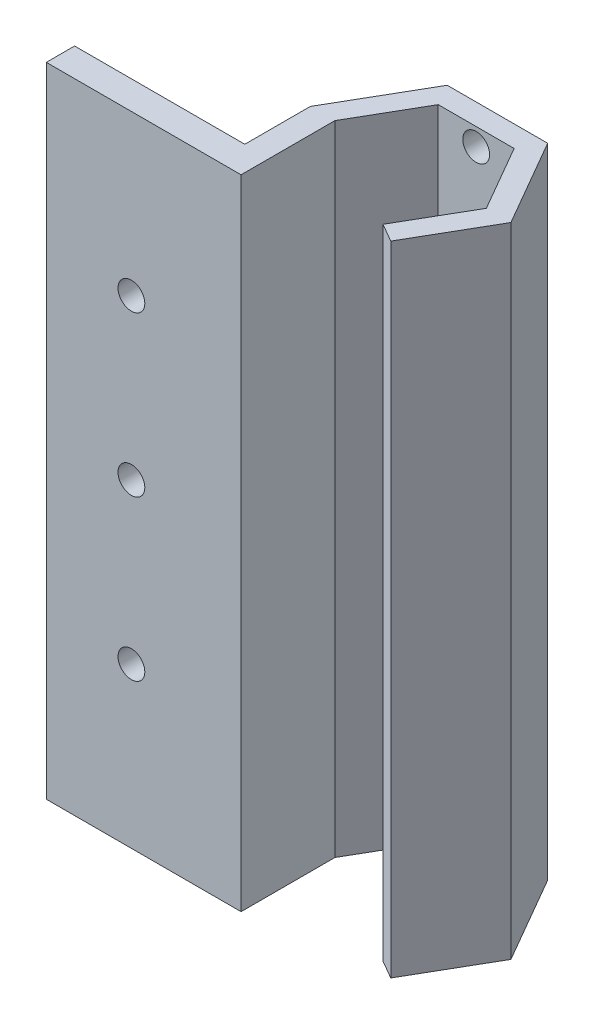
from build123d import *

# Parameters (mm, degrees)
BOSS_EXTRUDE3_DEPTH = 150
SKETCH5_R           = 3.15
CUT_EXTRUDE1_DEPTH  = 10
SKETCH6_R           = 3.15
CUT_EXTRUDE3_DEPTH  = 10
SKETCH7_W           = 23.61362601
SKETCH7_H           = 1.593343756
SKETCH7_H_2         = 3.851078854
BOSS_EXTRUDE4_DEPTH = 10


with BuildPart() as part:
    # Sketch4 → Boss-Extrude3 (new body)
    with BuildSketch(Plane(origin=(0, 0, 0), x_dir=(1, 0, 0), z_dir=(0, 1, 0))):
        Polygon((8.948929172, -15.4), (17.840123318, 0), (8.920061659, 15.45), (-8.920061659, 15.45), (-17.811255804, 0.05), (-17.811255804, -22), (-63.584758496, -22), (-63.584758496, -15.35), (-23.584758496, -15.35), (-23.584758496, 0.05), (-11.806813005, 20.45), (11.806813005, 20.45), (23.61362601, 0), (13.279056191, -17.9), align=None)
    extrude(amount=-BOSS_EXTRUDE3_DEPTH)

    # Sketch5 → Cut-Extrude1 (cut)
    with BuildSketch(Plane(origin=(0, 0, 15.35), x_dir=(-1, 0, 0), z_dir=(0, 0, -1))):
        with Locations((43.584758496, -37.5)):
            Circle(SKETCH5_R)
        with Locations((43.584758496, -75)):
            Circle(SKETCH5_R)
        with Locations((43.584758496, -112.5)):
            Circle(SKETCH5_R)
    extrude(amount=-CUT_EXTRUDE1_DEPTH, mode=Mode.SUBTRACT)

    # Sketch6 → Cut-Extrude3 (cut)
    with BuildSketch(Plane(origin=(0, 0, -20.45), x_dir=(-1, 0, 0), z_dir=(0, 0, -1))):
        with Locations((0, -4.15)):
            Circle(SKETCH6_R)
        with Locations((0, -145.85)):
            Circle(SKETCH6_R)
    extrude(amount=-CUT_EXTRUDE3_DEPTH, mode=Mode.SUBTRACT)

    # Sketch7 → Boss-Extrude4 (add)
    with BuildSketch(Plane(origin=(0, 0, -20.45), x_dir=(-1, 0, 0), z_dir=(0, 0, -1))):
        with Locations((0, -26.496671878)):
            Rectangle(SKETCH7_W, SKETCH7_H)
        with Locations((0, -122.374460573)):
            Rectangle(SKETCH7_W, SKETCH7_H_2)
    extrude(amount=-BOSS_EXTRUDE4_DEPTH)


solid = part.part
